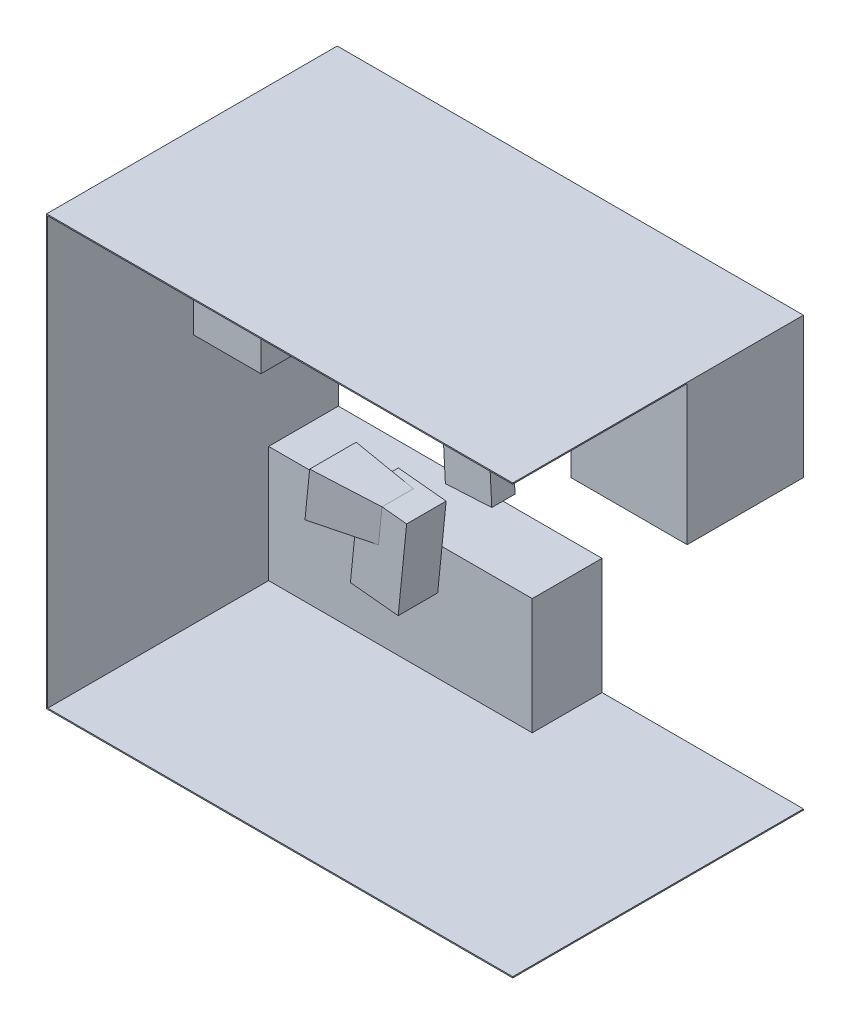
from build123d import *

# Parameters (mm, degrees)
SKETCH1_W            = 10
SKETCH1_H            = 3687.6
BOSS_EXTRUDE1_DEPTH  = 2500
BOSS_EXTRUDE2_DEPTH  = 2500
SKETCH3_3_W          = 2267.5
SKETCH3_3_H          = 1000
BOSS_EXTRUDE3_DEPTH  = 600
SKETCH3_4_W          = 558.8
SKETCH3_4_H          = 660.4
SKETCH3_4_W_2        = 578.8
SKETCH3_4_H_2        = 700.4
BOSS_EXTRUDE4_DEPTH  = 1244.6
BOSS_EXTRUDE5_DEPTH  = 200
SKETCH3_7_W          = 4000
SKETCH3_7_H          = 10
BOSS_EXTRUDE7_DEPTH  = 2500
SKETCH3_8_W          = 1000
SKETCH3_8_H          = 1200
BOSS_EXTRUDE8_DEPTH  = 1000
BOSS_EXTRUDE9_START  = 723.9
BOSS_EXTRUDE9_DEPTH  = 40
BOSS_EXTRUDE11_START = 723.9
BOSS_EXTRUDE11_DEPTH = 30
BOSS_EXTRUDE13_START = 723.9
BOSS_EXTRUDE13_DEPTH = 300
LOFT1_START          = 753.9
LOFT1_DEPTH          = 400
LOFT1_START_2        = 1343.22413698
LOFT1_2_DEPTH        = 126.77586302


with BuildPart() as part:
    # Sketch1 → Boss-Extrude1 (new body)
    with BuildSketch(Plane.XY):
        with Locations((0, 343.8)):
            Rectangle(SKETCH1_W, SKETCH1_H)
    extrude(amount=BOSS_EXTRUDE1_DEPTH)

    # Sketch3 → Boss-Extrude2 (add)
    with BuildSketch(Plane.XY):
        Polygon((3072.5, -1490), (2272.5, -1490), (5, -1490), (5, -1500), (4005, -1500), (4005, -1490), align=None)
    extrude(amount=BOSS_EXTRUDE2_DEPTH)

    # Sketch3<3> → Boss-Extrude3 (add)
    with BuildSketch(Plane.XY):
        with Locations((1138.75, -990)):
            Rectangle(SKETCH3_3_W, SKETCH3_3_H)
    extrude(amount=BOSS_EXTRUDE3_DEPTH)

    # Sketch3<4> → Boss-Extrude4 (add)
    with BuildSketch(Plane.XY):
        with Locations((284.4, 1012.930691938)):
            Rectangle(SKETCH3_4_W, SKETCH3_4_H)
        with Locations((294.4, 1012.930691938)):
            Rectangle(SKETCH3_4_W_2, SKETCH3_4_H_2)
    extrude(amount=BOSS_EXTRUDE4_DEPTH)

    # Sketch3<7> → Boss-Extrude7 (add)
    with BuildSketch(Plane.XY):
        with Locations((2005, 2182.6)):
            Rectangle(SKETCH3_7_W, SKETCH3_7_H)
    extrude(amount=BOSS_EXTRUDE7_DEPTH)

    # Sketch3<8> → Boss-Extrude8 (add)
    with BuildSketch(Plane.XY):
        with Locations((3505, 1577.6)):
            Rectangle(SKETCH3_8_W, SKETCH3_8_H)
    extrude(amount=BOSS_EXTRUDE8_DEPTH)


with BuildPart() as body_2:
    # Sketch3<5> → Boss-Extrude5 (new body)
    with BuildSketch(Plane.XY):
        Polygon((1125.118882054, -407.151961824), (1524.538051487, -385.603711559), (1473.738051487, 556.026980379), (1074.318882054, 534.478730114), align=None)
    extrude(amount=BOSS_EXTRUDE5_DEPTH)


with BuildPart() as body_3:
    # Sketch3<9> → Boss-Extrude9 (new body)
    with BuildSketch(Plane.XY.offset(BOSS_EXTRUDE9_START)):
        Polygon((1132.487942059, -728.803884792), (1205.162776182, -8.561162867), (1615.827486051, -49.998568288), (1543.152651928, -770.241290213), align=None)
    extrude(amount=-BOSS_EXTRUDE9_DEPTH)



with BuildPart() as body_4:
    # Sketch3<10> → Boss-Extrude11 (new body)
    with BuildSketch(Plane.XY.offset(BOSS_EXTRUDE11_START)):
        Polygon((1205.162776182, -8.561162867), (1175.044734689, -307.045506806), (1374.034297315, -327.124201135), (1404.152338808, -28.639857196), align=None)
    extrude(amount=BOSS_EXTRUDE11_DEPTH)


with BuildPart() as body_3_1:
    add(body_3.part)

    add(body_4.part)  # Boss-Extrude13 merges body 4
    # Sketch3<11> → Boss-Extrude13 (add)
    with BuildSketch(Plane.XY.offset(BOSS_EXTRUDE13_START)):
        Polygon((1132.487942059, -728.803884792), (1543.152651928, -770.241290213), (1615.827486051, -49.998568288), (1404.152338808, -28.639857196), (1374.034297315, -327.124201135), (1175.044734689, -307.045506806), align=None)
    extrude(amount=BOSS_EXTRUDE13_DEPTH)

    # Loft1: read off the stored shape, not the designer's step
    # Loft1 outline → Loft1 (add)
    with BuildSketch(Plane.XY.offset(LOFT1_START)):
        Polygon((911.698105825, 71.304269282), (871.540717168, -326.67485597), (1374.034297315, -327.124201135), (1404.152338808, -28.639857196), align=None)
    extrude(amount=LOFT1_DEPTH)

    # Loft1 2 outline → Loft1 2 (cut)
    with BuildSketch(Plane(origin=(0, 0, 0), x_dir=(0.9681521540004261, 0.006532813937532859, -0.25027730429743866), z_dir=(0.25036255052290696, -0.025262395961762493, 0.9678225067882728)).offset(LOFT1_START_2)):
        with BuildLine():
            add(Edge.make_bspline(
                [(594.333321048, 101.389182409), (763.884574243, 66.955102294), (933.435827438, 32.52102218), (1102.987080633, -1.913057935)],
                knots=[0, 0, 0, 0, 1, 1, 1, 1], degree=3))
            Line((594.333321048, 101.389182409), (552.854935144, -296.454434484))
            add(Edge.make_bspline(
                [(552.854935144, -296.454434484), (725.862720498, -297.734879858), (898.870505851, -299.015325231), (1071.878291205, -300.295770605)],
                knots=[0, 0, 0, 0, 1, 1, 1, 1], degree=3))
            Line((1071.878291205, -300.295770605), (1102.987080633, -1.913057935))
        make_face()
    extrude(amount=LOFT1_2_DEPTH, mode=Mode.SUBTRACT)


solid = Compound([part.part, body_2.part, body_3_1.part])
